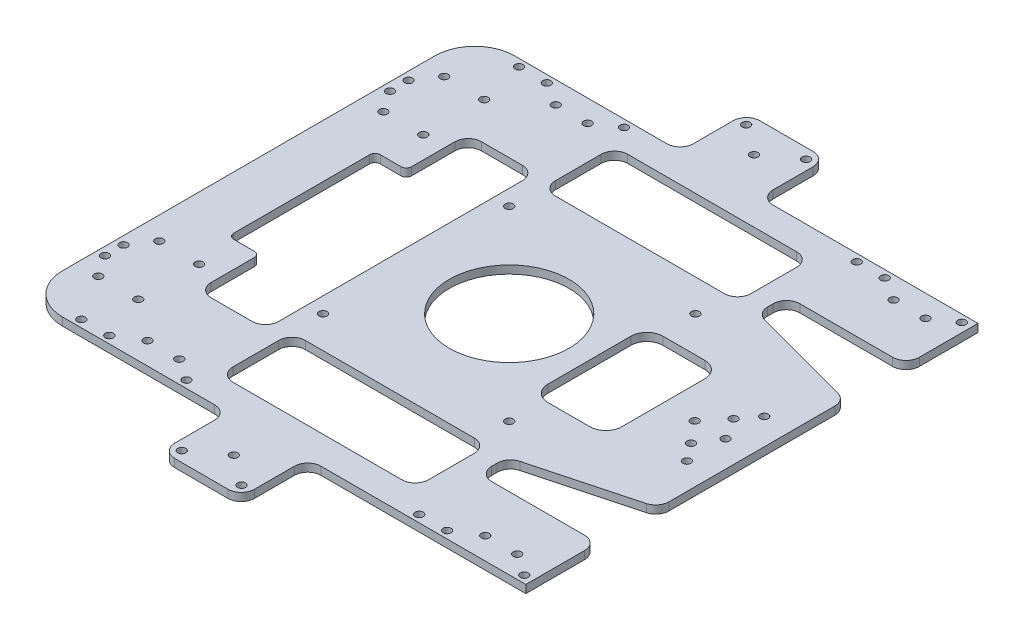
from build123d import *

# Parameters (mm, degrees)
SKETCH_1_R          = 1.5
SKETCH_1_R_2        = 22.5
SKETCH_1_W          = 25.382711005
SKETCH_1_H          = 101.626444412
SKETCH_1_W_2        = 73.520704478
SKETCH_1_H_2        = 27.206983468
SKETCH_1_W_3        = 27.767362264
SKETCH_1_H_3        = 43.217403646
EXTRUDE_1_DEPTH     = 3
FILLET_2_R          = 15
FILLET_3_R          = 15
SKETCH_2_R          = 1.5
CUT_EXTRUDE_1_DEPTH = 148.313428512
FILLET_6_R          = 5
FILLET_7_R          = 5
CUT_EXTRUDE_2_REACH = 149.313
SKETCH_3_R          = 1.5
FILLET_8_R          = 6
SKETCH_4_W          = 15.916712198
SKETCH_4_H          = 55.113170874
CUT_EXTRUDE_3_DEPTH = 148.313428512
FILLET_9_R          = 2
FILLET_10_R         = 2


with BuildPart() as part:
    # 草图1 → 凸台-拉伸1 (new body)
    with BuildSketch(Plane(origin=(0, 0, 0), x_dir=(1, 0, 0), z_dir=(0, 1, 0))):
        with BuildLine():
            Line((-91.25, 85), (-97.959535954, 85))
            Line((-97.959535954, 85), (-97.959535954, -85))
            Line((-97.959535954, -85), (-91.25, -85))
            Line((-91.25, -85), (-35.75, -85))
            Line((-35.75, -85), (-25.75, -85))
            ThreePointArc((-25.75, -85), (-22.214466094, -86.464466094), (-20.75, -90))
            Line((-20.75, -90), (-20.75, -104.982614697))
            ThreePointArc((-20.75, -104.982614697), (-19.285533906, -108.518148603), (-15.75, -109.982614697))
            Line((-15.75, -109.982614697), (4.25, -109.982614697))
            ThreePointArc((4.25, -109.982614697), (7.785533906, -108.518148603), (9.25, -104.982614697))
            Line((9.25, -104.982614697), (9.25, -90))
            ThreePointArc((9.25, -90), (10.714466094, -86.464466094), (14.25, -85))
            Line((14.25, -85), (44.25, -85))
            Line((44.25, -85), (91.25, -85))
            Line((91.25, -85), (91.25, -57.918235785))
            Line((91.25, -57.918235785), (46.355968051, -57.918235785))
            Line((46.355968051, -57.918235785), (46.355968051, -47.006199804))
            Line((46.355968051, -47.006199804), (91.25, -35))
            Line((91.25, -35), (91.25, 35))
            Line((91.25, 35), (46.355968051, 47.006199804))
            Line((46.355968051, 47.006199804), (46.355968051, 57.918235785))
            Line((46.355968051, 57.918235785), (91.25, 57.918235785))
            Line((91.25, 57.918235785), (91.25, 85))
            Line((91.25, 85), (44.25, 85))
            Line((44.25, 85), (14.25, 85))
            ThreePointArc((14.25, 85), (10.714466094, 86.464466094), (9.25, 90))
            Line((9.25, 90), (9.25, 104.982614697))
            ThreePointArc((9.25, 104.982614697), (7.785533906, 108.518148603), (4.25, 109.982614697))
            Line((4.25, 109.982614697), (-15.75, 109.982614697))
            ThreePointArc((-15.75, 109.982614697), (-19.285533906, 108.518148603), (-20.75, 104.982614697))
            Line((-20.75, 104.982614697), (-20.75, 90))
            ThreePointArc((-20.75, 90), (-22.214466094, 86.464466094), (-25.75, 85))
            Line((-25.75, 85), (-35.75, 85))
            Line((-35.75, 85), (-91.25, 85))
        make_face()
        with Locations((-89.443571008, 65.02483454)):
            Circle(SKETCH_1_R, mode=Mode.SUBTRACT)
        with Locations((-74.443571008, 65.02483454)):
            Circle(SKETCH_1_R, mode=Mode.SUBTRACT)
        with Locations((-78.590757383, -82.25)):
            Circle(SKETCH_1_R, mode=Mode.SUBTRACT)
        with Locations((-68.090757383, -82.25)):
            Circle(SKETCH_1_R, mode=Mode.SUBTRACT)
        with Locations((-39.090757383, -82.25)):
            Circle(SKETCH_1_R, mode=Mode.SUBTRACT)
        with Locations((48.409242617, -82.25)):
            Circle(SKETCH_1_R, mode=Mode.SUBTRACT)
        with Locations((58.909242617, -82.25)):
            Circle(SKETCH_1_R, mode=Mode.SUBTRACT)
        with Locations((87.909242617, -82.25)):
            Circle(SKETCH_1_R, mode=Mode.SUBTRACT)
        with Locations((-78.590757383, 82.25)):
            Circle(SKETCH_1_R, mode=Mode.SUBTRACT)
        with Locations((-68.090757383, 82.25)):
            Circle(SKETCH_1_R, mode=Mode.SUBTRACT)
        with Locations((-39.090757383, 82.25)):
            Circle(SKETCH_1_R, mode=Mode.SUBTRACT)
        with Locations((48.409242617, 82.25)):
            Circle(SKETCH_1_R, mode=Mode.SUBTRACT)
        with Locations((58.909242617, 82.25)):
            Circle(SKETCH_1_R, mode=Mode.SUBTRACT)
        with Locations((87.909242617, 82.25)):
            Circle(SKETCH_1_R, mode=Mode.SUBTRACT)
        with Locations((-59.25, 76.75)):
            Circle(SKETCH_1_R, mode=Mode.SUBTRACT)
        with Locations((-47.25, 76.75)):
            Circle(SKETCH_1_R, mode=Mode.SUBTRACT)
        with Locations((-59.25, -76.75)):
            Circle(SKETCH_1_R, mode=Mode.SUBTRACT)
        with Locations((-47.25, -76.75)):
            Circle(SKETCH_1_R, mode=Mode.SUBTRACT)
        with Locations((67.75, 76.75)):
            Circle(SKETCH_1_R, mode=Mode.SUBTRACT)
        with Locations((79.75, 76.75)):
            Circle(SKETCH_1_R, mode=Mode.SUBTRACT)
        with Locations((67.75, -76.75)):
            Circle(SKETCH_1_R, mode=Mode.SUBTRACT)
        with Locations((79.75, -76.75)):
            Circle(SKETCH_1_R, mode=Mode.SUBTRACT)
        with Locations((-89.443571008, 42.133112371)):
            Circle(SKETCH_1_R, mode=Mode.SUBTRACT)
        with Locations((-74.443571008, 42.133112371)):
            Circle(SKETCH_1_R, mode=Mode.SUBTRACT)
        with Locations((-35, 35)):
            Circle(SKETCH_1_R, mode=Mode.SUBTRACT)
        with Locations((-35, -35)):
            Circle(SKETCH_1_R, mode=Mode.SUBTRACT)
        with Locations((35, -35)):
            Circle(SKETCH_1_R, mode=Mode.SUBTRACT)
        with Locations((35, 35)):
            Circle(SKETCH_1_R, mode=Mode.SUBTRACT)
        with Locations((-17, -106.1)):
            Circle(SKETCH_1_R, mode=Mode.SUBTRACT)
        with Locations((5.5, -106.1)):
            Circle(SKETCH_1_R, mode=Mode.SUBTRACT)
        with Locations((5.5, 106.1)):
            Circle(SKETCH_1_R, mode=Mode.SUBTRACT)
        with Locations((-17, 106.1)):
            Circle(SKETCH_1_R, mode=Mode.SUBTRACT)
        Circle(SKETCH_1_R_2, mode=Mode.SUBTRACT)
        with Locations((-74.443571008, -42.133112371)):
            Circle(SKETCH_1_R, mode=Mode.SUBTRACT)
        with Locations((-89.443571008, -42.133112371)):
            Circle(SKETCH_1_R, mode=Mode.SUBTRACT)
        with Locations((-74.443571008, -65.02483454)):
            Circle(SKETCH_1_R, mode=Mode.SUBTRACT)
        with Locations((-89.443571008, -65.02483454)):
            Circle(SKETCH_1_R, mode=Mode.SUBTRACT)
        with Locations((-5.75, -97.789393477)):
            Circle(SKETCH_1_R, mode=Mode.SUBTRACT)
        with Locations((-5.75, 97.789393477)):
            Circle(SKETCH_1_R, mode=Mode.SUBTRACT)
        with Locations((-53.537495084, 0)):
            Rectangle(SKETCH_1_W, SKETCH_1_H, mode=Mode.SUBTRACT)
        with Locations((2.120156715, -60.609691538)):
            Rectangle(SKETCH_1_W_2, SKETCH_1_H_2, mode=Mode.SUBTRACT)
        with Locations((2.120156715, 60.609691538)):
            Rectangle(SKETCH_1_W_2, SKETCH_1_H_2, mode=Mode.SUBTRACT)
        with Locations((44.056842955, 0)):
            Rectangle(SKETCH_1_W_3, SKETCH_1_H_3, mode=Mode.SUBTRACT)
    extrude(amount=EXTRUDE_1_DEPTH)

    # 圆角2
    fillet_2_edges = [part.edges().sort_by_distance(p)[0] for p in [
        (-97.959535954, 1.5, -85),
    ]]
    fillet(fillet_2_edges, radius=FILLET_2_R)

    # 圆角3
    fillet_3_edges = [part.edges().sort_by_distance(p)[0] for p in [
        (-97.959535954, 1.5, 85),
    ]]
    fillet(fillet_3_edges, radius=FILLET_3_R)

    # 草图2 → 切除-拉伸1 (cut, through all)
    with BuildSketch(Plane(origin=(0, 3, 0), x_dir=(1, 0, 0), z_dir=(0, 1, 0))):
        with Locations((-94.88992508, 57.078973455)):
            Circle(SKETCH_2_R)
        with Locations((-94.88992508, 50.078973455)):
            Circle(SKETCH_2_R)
        with Locations((-94.88992508, -50.078973455)):
            Circle(SKETCH_2_R)
        with Locations((-94.88992508, -57.078973455)):
            Circle(SKETCH_2_R)
    extrude(amount=-CUT_EXTRUDE_1_DEPTH, mode=Mode.SUBTRACT)

    # 圆角6
    fillet_6_edges = [part.edges().sort_by_distance(p)[0] for p in [
        (-40.846139581, 1.5, 50.813222206),
        (-66.228850586, 1.5, 50.813222206),
        (-66.228850586, 1.5, -50.813222206),
        (-40.846139581, 1.5, -50.813222206),
        (46.355968051, 1.5, -57.918235785),
        (91.25, 1.5, -57.918235785),
        (91.25, 1.5, 57.918235785),
        (91.25, 1.5, -35),
        (91.25, 1.5, 35),
        (46.355968051, 1.5, -47.006199804),
        (46.355968051, 1.5, 47.006199804),
        (46.355968051, 1.5, 57.918235785),
    ]]
    fillet(fillet_6_edges, radius=FILLET_6_R)

    # 圆角7
    fillet_7_edges = [part.edges().sort_by_distance(p)[0] for p in [
        (-34.640195524, 1.5, -47.006199804),
        (38.880508954, 1.5, -47.006199804),
        (38.880508954, 1.5, -74.213183272),
        (-34.640195524, 1.5, -74.213183272),
        (38.880508954, 1.5, 74.213183272),
        (-34.640195524, 1.5, 74.213183272),
        (38.880508954, 1.5, 47.006199804),
        (-34.640195524, 1.5, 47.006199804),
    ]]
    fillet(fillet_7_edges, radius=FILLET_7_R)

    # 草图3 → 切除-拉伸2 (cut, up to next)
    with BuildSketch(Plane(origin=(0, 3, 0), x_dir=(1, 0, 0), z_dir=(0, 1, 0)), mode=Mode.PRIVATE) as cut_extrude_2_sk1:
        with Locations((81.362549907, 14.526154224)):
            Circle(SKETCH_3_R)
    cut_extrude_2_tool1 = extrude(cut_extrude_2_sk1.sketch, amount=-CUT_EXTRUDE_2_REACH, mode=Mode.PRIVATE) & part.part
    # 草图3 → 切除-拉伸2 (cut, up to next)
    with BuildSketch(Plane(origin=(0, 3, 0), x_dir=(1, 0, 0), z_dir=(0, 1, 0)), mode=Mode.PRIVATE) as cut_extrude_2_sk2:
        with Locations((81.362549907, -14.526154224)):
            Circle(SKETCH_3_R)
    cut_extrude_2_tool2 = extrude(cut_extrude_2_sk2.sketch, amount=-CUT_EXTRUDE_2_REACH, mode=Mode.PRIVATE) & part.part
    # 草图3 → 切除-拉伸2 (cut, up to next)
    with BuildSketch(Plane(origin=(0, 3, 0), x_dir=(1, 0, 0), z_dir=(0, 1, 0)), mode=Mode.PRIVATE) as cut_extrude_2_sk3:
        with Locations((76.342072613, -7.976309366)):
            Circle(SKETCH_3_R)
    cut_extrude_2_tool3 = extrude(cut_extrude_2_sk3.sketch, amount=-CUT_EXTRUDE_2_REACH, mode=Mode.PRIVATE) & part.part
    # 草图3 → 切除-拉伸2 (cut, up to next)
    with BuildSketch(Plane(origin=(0, 3, 0), x_dir=(1, 0, 0), z_dir=(0, 1, 0)), mode=Mode.PRIVATE) as cut_extrude_2_sk4:
        with Locations((76.342072613, 7.976309366)):
            Circle(SKETCH_3_R)
    cut_extrude_2_tool4 = extrude(cut_extrude_2_sk4.sketch, amount=-CUT_EXTRUDE_2_REACH, mode=Mode.PRIVATE) & part.part
    # 草图3 → 切除-拉伸2 (cut, up to next)
    with BuildSketch(Plane(origin=(0, 3, 0), x_dir=(1, 0, 0), z_dir=(0, 1, 0)), mode=Mode.PRIVATE) as cut_extrude_2_sk5:
        with Locations((81.362549907, 0)):
            Circle(SKETCH_3_R)
    cut_extrude_2_tool5 = extrude(cut_extrude_2_sk5.sketch, amount=-CUT_EXTRUDE_2_REACH, mode=Mode.PRIVATE) & part.part
    # 草图3 → 切除-拉伸2 (cut, up to next)
    with BuildSketch(Plane(origin=(0, 3, 0), x_dir=(1, 0, 0), z_dir=(0, 1, 0)), mode=Mode.PRIVATE) as cut_extrude_2_sk6:
        with Locations((69.731720894, 0)):
            Circle(SKETCH_3_R)
    cut_extrude_2_tool6 = extrude(cut_extrude_2_sk6.sketch, amount=-CUT_EXTRUDE_2_REACH, mode=Mode.PRIVATE) & part.part
    add(cut_extrude_2_tool1.solids().sort_by_distance((81.36255, 3, -14.526154))[0], mode=Mode.SUBTRACT)
    add(cut_extrude_2_tool2.solids().sort_by_distance((81.36255, 3, 14.526154))[0], mode=Mode.SUBTRACT)
    add(cut_extrude_2_tool3.solids().sort_by_distance((76.342073, 3, 7.976309))[0], mode=Mode.SUBTRACT)
    add(cut_extrude_2_tool4.solids().sort_by_distance((76.342073, 3, -7.976309))[0], mode=Mode.SUBTRACT)
    add(cut_extrude_2_tool5.solids().sort_by_distance((81.36255, 3, 0))[0], mode=Mode.SUBTRACT)
    add(cut_extrude_2_tool6.solids().sort_by_distance((69.731721, 3, 0))[0], mode=Mode.SUBTRACT)

    # 圆角8
    fillet_8_edges = [part.edges().sort_by_distance(p)[0] for p in [
        (30.173161823, 1.5, 21.608701823),
        (57.940524087, 1.5, 21.608701823),
        (57.940524087, 1.5, -21.608701823),
        (30.173161823, 1.5, -21.608701823),
    ]]
    fillet(fillet_8_edges, radius=FILLET_8_R)

    # 草图4 → 切除-拉伸3 (cut, through all)
    with BuildSketch(Plane(origin=(0, 3, 0), x_dir=(1, 0, 0), z_dir=(0, 1, 0))):
        with Locations((-70.063199579, 0)):
            Rectangle(SKETCH_4_W, SKETCH_4_H)
    extrude(amount=-CUT_EXTRUDE_3_DEPTH, mode=Mode.SUBTRACT)

    # 圆角9
    fillet_9_edges = [part.edges().sort_by_distance(p)[0] for p in [
        (-78.021555678, 1.5, -27.556585437),
        (-78.021555678, 1.5, 27.556585437),
    ]]
    fillet(fillet_9_edges, radius=FILLET_9_R)

    # 圆角10
    fillet_10_edges = [part.edges().sort_by_distance(p)[0] for p in [
        (-66.228850586, 1.5, 27.556585437),
        (-66.228850586, 1.5, -27.556585437),
    ]]
    fillet(fillet_10_edges, radius=FILLET_10_R)


solid = part.part
